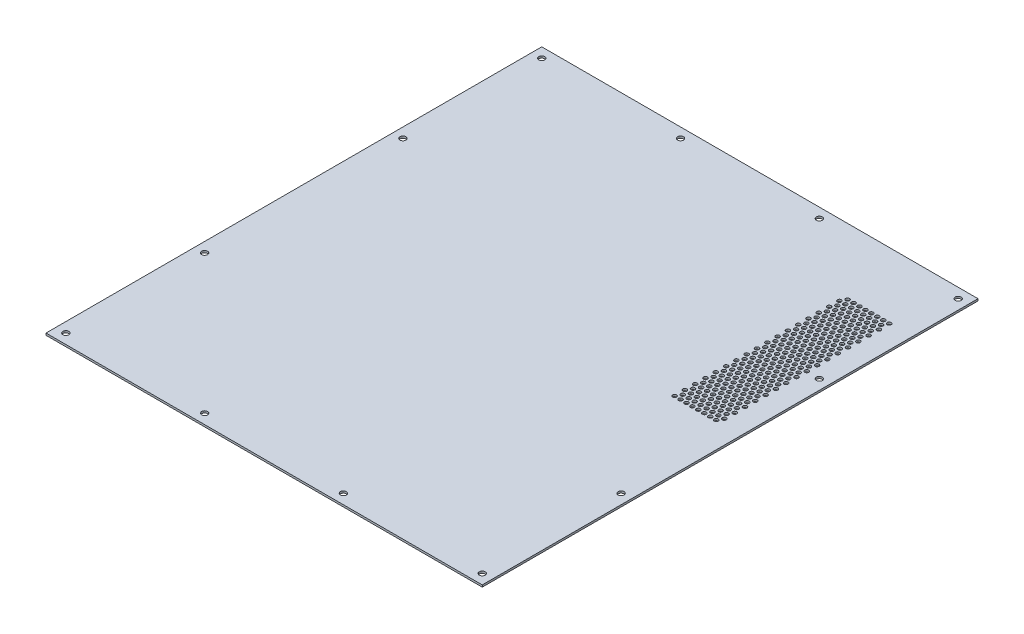
from build123d import *

# Parameters (mm, degrees)
SKETCH1_W           = 440
SKETCH1_H           = 500
SKETCH1_R           = 2
SKETCH1_R_2         = 3
BOSS_EXTRUDE1_DEPTH = 2


with BuildPart() as part:
    # Sketch1 → Boss-Extrude1 (new body)
    with BuildSketch(Plane(origin=(0, 0, 0), x_dir=(1, 0, 0), z_dir=(0, 1, 0))):
        with Locations((220, 250)):
            Rectangle(SKETCH1_W, SKETCH1_H)
        with Locations((372, 262)):
            Circle(SKETCH1_R, mode=Mode.SUBTRACT)
        with Locations((375, 267.196152423)):
            Circle(SKETCH1_R, mode=Mode.SUBTRACT)
        with Locations((381, 267.196152423)):
            Circle(SKETCH1_R, mode=Mode.SUBTRACT)
        with Locations((378, 262)):
            Circle(SKETCH1_R, mode=Mode.SUBTRACT)
        with Locations((387, 267.196152423)):
            Circle(SKETCH1_R, mode=Mode.SUBTRACT)
        with Locations((384, 262)):
            Circle(SKETCH1_R, mode=Mode.SUBTRACT)
        with Locations((393, 267.196152423)):
            Circle(SKETCH1_R, mode=Mode.SUBTRACT)
        with Locations((390, 262)):
            Circle(SKETCH1_R, mode=Mode.SUBTRACT)
        with Locations((399, 267.196152423)):
            Circle(SKETCH1_R, mode=Mode.SUBTRACT)
        with Locations((396, 262)):
            Circle(SKETCH1_R, mode=Mode.SUBTRACT)
        with Locations((405, 267.196152423)):
            Circle(SKETCH1_R, mode=Mode.SUBTRACT)
        with Locations((402, 262)):
            Circle(SKETCH1_R, mode=Mode.SUBTRACT)
        with Locations((411, 267.196152423)):
            Circle(SKETCH1_R, mode=Mode.SUBTRACT)
        with Locations((408, 262)):
            Circle(SKETCH1_R, mode=Mode.SUBTRACT)
        with Locations((417, 267.196152423)):
            Circle(SKETCH1_R, mode=Mode.SUBTRACT)
        with Locations((414, 262)):
            Circle(SKETCH1_R, mode=Mode.SUBTRACT)
        with Locations((381, 277.586152423)):
            Circle(SKETCH1_R, mode=Mode.SUBTRACT)
        with Locations((378, 272.39)):
            Circle(SKETCH1_R, mode=Mode.SUBTRACT)
        with Locations((387, 277.586152423)):
            Circle(SKETCH1_R, mode=Mode.SUBTRACT)
        with Locations((384, 272.39)):
            Circle(SKETCH1_R, mode=Mode.SUBTRACT)
        with Locations((393, 277.586152423)):
            Circle(SKETCH1_R, mode=Mode.SUBTRACT)
        with Locations((390, 272.39)):
            Circle(SKETCH1_R, mode=Mode.SUBTRACT)
        with Locations((399, 277.586152423)):
            Circle(SKETCH1_R, mode=Mode.SUBTRACT)
        with Locations((396, 272.39)):
            Circle(SKETCH1_R, mode=Mode.SUBTRACT)
        with Locations((405, 277.586152423)):
            Circle(SKETCH1_R, mode=Mode.SUBTRACT)
        with Locations((402, 272.39)):
            Circle(SKETCH1_R, mode=Mode.SUBTRACT)
        with Locations((411, 277.586152423)):
            Circle(SKETCH1_R, mode=Mode.SUBTRACT)
        with Locations((408, 272.39)):
            Circle(SKETCH1_R, mode=Mode.SUBTRACT)
        with Locations((417, 277.586152423)):
            Circle(SKETCH1_R, mode=Mode.SUBTRACT)
        with Locations((414, 272.39)):
            Circle(SKETCH1_R, mode=Mode.SUBTRACT)
        with Locations((381, 287.976152423)):
            Circle(SKETCH1_R, mode=Mode.SUBTRACT)
        with Locations((378, 282.78)):
            Circle(SKETCH1_R, mode=Mode.SUBTRACT)
        with Locations((387, 287.976152423)):
            Circle(SKETCH1_R, mode=Mode.SUBTRACT)
        with Locations((384, 282.78)):
            Circle(SKETCH1_R, mode=Mode.SUBTRACT)
        with Locations((393, 287.976152423)):
            Circle(SKETCH1_R, mode=Mode.SUBTRACT)
        with Locations((390, 282.78)):
            Circle(SKETCH1_R, mode=Mode.SUBTRACT)
        with Locations((399, 287.976152423)):
            Circle(SKETCH1_R, mode=Mode.SUBTRACT)
        with Locations((396, 282.78)):
            Circle(SKETCH1_R, mode=Mode.SUBTRACT)
        with Locations((405, 287.976152423)):
            Circle(SKETCH1_R, mode=Mode.SUBTRACT)
        with Locations((402, 282.78)):
            Circle(SKETCH1_R, mode=Mode.SUBTRACT)
        with Locations((411, 287.976152423)):
            Circle(SKETCH1_R, mode=Mode.SUBTRACT)
        with Locations((408, 282.78)):
            Circle(SKETCH1_R, mode=Mode.SUBTRACT)
        with Locations((417, 287.976152423)):
            Circle(SKETCH1_R, mode=Mode.SUBTRACT)
        with Locations((414, 282.78)):
            Circle(SKETCH1_R, mode=Mode.SUBTRACT)
        with Locations((381, 298.366152423)):
            Circle(SKETCH1_R, mode=Mode.SUBTRACT)
        with Locations((378, 293.17)):
            Circle(SKETCH1_R, mode=Mode.SUBTRACT)
        with Locations((387, 298.366152423)):
            Circle(SKETCH1_R, mode=Mode.SUBTRACT)
        with Locations((384, 293.17)):
            Circle(SKETCH1_R, mode=Mode.SUBTRACT)
        with Locations((393, 298.366152423)):
            Circle(SKETCH1_R, mode=Mode.SUBTRACT)
        with Locations((390, 293.17)):
            Circle(SKETCH1_R, mode=Mode.SUBTRACT)
        with Locations((399, 298.366152423)):
            Circle(SKETCH1_R, mode=Mode.SUBTRACT)
        with Locations((396, 293.17)):
            Circle(SKETCH1_R, mode=Mode.SUBTRACT)
        with Locations((405, 298.366152423)):
            Circle(SKETCH1_R, mode=Mode.SUBTRACT)
        with Locations((402, 293.17)):
            Circle(SKETCH1_R, mode=Mode.SUBTRACT)
        with Locations((411, 298.366152423)):
            Circle(SKETCH1_R, mode=Mode.SUBTRACT)
        with Locations((408, 293.17)):
            Circle(SKETCH1_R, mode=Mode.SUBTRACT)
        with Locations((417, 298.366152423)):
            Circle(SKETCH1_R, mode=Mode.SUBTRACT)
        with Locations((414, 293.17)):
            Circle(SKETCH1_R, mode=Mode.SUBTRACT)
        with Locations((381, 308.756152423)):
            Circle(SKETCH1_R, mode=Mode.SUBTRACT)
        with Locations((378, 303.56)):
            Circle(SKETCH1_R, mode=Mode.SUBTRACT)
        with Locations((387, 308.756152423)):
            Circle(SKETCH1_R, mode=Mode.SUBTRACT)
        with Locations((384, 303.56)):
            Circle(SKETCH1_R, mode=Mode.SUBTRACT)
        with Locations((393, 308.756152423)):
            Circle(SKETCH1_R, mode=Mode.SUBTRACT)
        with Locations((390, 303.56)):
            Circle(SKETCH1_R, mode=Mode.SUBTRACT)
        with Locations((399, 308.756152423)):
            Circle(SKETCH1_R, mode=Mode.SUBTRACT)
        with Locations((396, 303.56)):
            Circle(SKETCH1_R, mode=Mode.SUBTRACT)
        with Locations((405, 308.756152423)):
            Circle(SKETCH1_R, mode=Mode.SUBTRACT)
        with Locations((402, 303.56)):
            Circle(SKETCH1_R, mode=Mode.SUBTRACT)
        with Locations((411, 308.756152423)):
            Circle(SKETCH1_R, mode=Mode.SUBTRACT)
        with Locations((408, 303.56)):
            Circle(SKETCH1_R, mode=Mode.SUBTRACT)
        with Locations((417, 308.756152423)):
            Circle(SKETCH1_R, mode=Mode.SUBTRACT)
        with Locations((414, 303.56)):
            Circle(SKETCH1_R, mode=Mode.SUBTRACT)
        with Locations((381, 319.146152423)):
            Circle(SKETCH1_R, mode=Mode.SUBTRACT)
        with Locations((378, 313.95)):
            Circle(SKETCH1_R, mode=Mode.SUBTRACT)
        with Locations((387, 319.146152423)):
            Circle(SKETCH1_R, mode=Mode.SUBTRACT)
        with Locations((384, 313.95)):
            Circle(SKETCH1_R, mode=Mode.SUBTRACT)
        with Locations((393, 319.146152423)):
            Circle(SKETCH1_R, mode=Mode.SUBTRACT)
        with Locations((390, 313.95)):
            Circle(SKETCH1_R, mode=Mode.SUBTRACT)
        with Locations((399, 319.146152423)):
            Circle(SKETCH1_R, mode=Mode.SUBTRACT)
        with Locations((396, 313.95)):
            Circle(SKETCH1_R, mode=Mode.SUBTRACT)
        with Locations((405, 319.146152423)):
            Circle(SKETCH1_R, mode=Mode.SUBTRACT)
        with Locations((402, 313.95)):
            Circle(SKETCH1_R, mode=Mode.SUBTRACT)
        with Locations((411, 319.146152423)):
            Circle(SKETCH1_R, mode=Mode.SUBTRACT)
        with Locations((408, 313.95)):
            Circle(SKETCH1_R, mode=Mode.SUBTRACT)
        with Locations((417, 319.146152423)):
            Circle(SKETCH1_R, mode=Mode.SUBTRACT)
        with Locations((414, 313.95)):
            Circle(SKETCH1_R, mode=Mode.SUBTRACT)
        with Locations((381, 329.536152423)):
            Circle(SKETCH1_R, mode=Mode.SUBTRACT)
        with Locations((378, 324.34)):
            Circle(SKETCH1_R, mode=Mode.SUBTRACT)
        with Locations((387, 329.536152423)):
            Circle(SKETCH1_R, mode=Mode.SUBTRACT)
        with Locations((384, 324.34)):
            Circle(SKETCH1_R, mode=Mode.SUBTRACT)
        with Locations((393, 329.536152423)):
            Circle(SKETCH1_R, mode=Mode.SUBTRACT)
        with Locations((390, 324.34)):
            Circle(SKETCH1_R, mode=Mode.SUBTRACT)
        with Locations((399, 329.536152423)):
            Circle(SKETCH1_R, mode=Mode.SUBTRACT)
        with Locations((396, 324.34)):
            Circle(SKETCH1_R, mode=Mode.SUBTRACT)
        with Locations((405, 329.536152423)):
            Circle(SKETCH1_R, mode=Mode.SUBTRACT)
        with Locations((402, 324.34)):
            Circle(SKETCH1_R, mode=Mode.SUBTRACT)
        with Locations((411, 329.536152423)):
            Circle(SKETCH1_R, mode=Mode.SUBTRACT)
        with Locations((408, 324.34)):
            Circle(SKETCH1_R, mode=Mode.SUBTRACT)
        with Locations((417, 329.536152423)):
            Circle(SKETCH1_R, mode=Mode.SUBTRACT)
        with Locations((414, 324.34)):
            Circle(SKETCH1_R, mode=Mode.SUBTRACT)
        with Locations((381, 339.926152423)):
            Circle(SKETCH1_R, mode=Mode.SUBTRACT)
        with Locations((378, 334.73)):
            Circle(SKETCH1_R, mode=Mode.SUBTRACT)
        with Locations((387, 339.926152423)):
            Circle(SKETCH1_R, mode=Mode.SUBTRACT)
        with Locations((384, 334.73)):
            Circle(SKETCH1_R, mode=Mode.SUBTRACT)
        with Locations((393, 339.926152423)):
            Circle(SKETCH1_R, mode=Mode.SUBTRACT)
        with Locations((390, 334.73)):
            Circle(SKETCH1_R, mode=Mode.SUBTRACT)
        with Locations((399, 339.926152423)):
            Circle(SKETCH1_R, mode=Mode.SUBTRACT)
        with Locations((396, 334.73)):
            Circle(SKETCH1_R, mode=Mode.SUBTRACT)
        with Locations((405, 339.926152423)):
            Circle(SKETCH1_R, mode=Mode.SUBTRACT)
        with Locations((402, 334.73)):
            Circle(SKETCH1_R, mode=Mode.SUBTRACT)
        with Locations((411, 339.926152423)):
            Circle(SKETCH1_R, mode=Mode.SUBTRACT)
        with Locations((408, 334.73)):
            Circle(SKETCH1_R, mode=Mode.SUBTRACT)
        with Locations((417, 339.926152423)):
            Circle(SKETCH1_R, mode=Mode.SUBTRACT)
        with Locations((414, 334.73)):
            Circle(SKETCH1_R, mode=Mode.SUBTRACT)
        with Locations((381, 350.316152423)):
            Circle(SKETCH1_R, mode=Mode.SUBTRACT)
        with Locations((378, 345.12)):
            Circle(SKETCH1_R, mode=Mode.SUBTRACT)
        with Locations((387, 350.316152423)):
            Circle(SKETCH1_R, mode=Mode.SUBTRACT)
        with Locations((384, 345.12)):
            Circle(SKETCH1_R, mode=Mode.SUBTRACT)
        with Locations((393, 350.316152423)):
            Circle(SKETCH1_R, mode=Mode.SUBTRACT)
        with Locations((390, 345.12)):
            Circle(SKETCH1_R, mode=Mode.SUBTRACT)
        with Locations((399, 350.316152423)):
            Circle(SKETCH1_R, mode=Mode.SUBTRACT)
        with Locations((396, 345.12)):
            Circle(SKETCH1_R, mode=Mode.SUBTRACT)
        with Locations((405, 350.316152423)):
            Circle(SKETCH1_R, mode=Mode.SUBTRACT)
        with Locations((402, 345.12)):
            Circle(SKETCH1_R, mode=Mode.SUBTRACT)
        with Locations((411, 350.316152423)):
            Circle(SKETCH1_R, mode=Mode.SUBTRACT)
        with Locations((408, 345.12)):
            Circle(SKETCH1_R, mode=Mode.SUBTRACT)
        with Locations((417, 350.316152423)):
            Circle(SKETCH1_R, mode=Mode.SUBTRACT)
        with Locations((414, 345.12)):
            Circle(SKETCH1_R, mode=Mode.SUBTRACT)
        with Locations((381, 360.706152423)):
            Circle(SKETCH1_R, mode=Mode.SUBTRACT)
        with Locations((378, 355.51)):
            Circle(SKETCH1_R, mode=Mode.SUBTRACT)
        with Locations((387, 360.706152423)):
            Circle(SKETCH1_R, mode=Mode.SUBTRACT)
        with Locations((384, 355.51)):
            Circle(SKETCH1_R, mode=Mode.SUBTRACT)
        with Locations((393, 360.706152423)):
            Circle(SKETCH1_R, mode=Mode.SUBTRACT)
        with Locations((390, 355.51)):
            Circle(SKETCH1_R, mode=Mode.SUBTRACT)
        with Locations((399, 360.706152423)):
            Circle(SKETCH1_R, mode=Mode.SUBTRACT)
        with Locations((396, 355.51)):
            Circle(SKETCH1_R, mode=Mode.SUBTRACT)
        with Locations((405, 360.706152423)):
            Circle(SKETCH1_R, mode=Mode.SUBTRACT)
        with Locations((402, 355.51)):
            Circle(SKETCH1_R, mode=Mode.SUBTRACT)
        with Locations((411, 360.706152423)):
            Circle(SKETCH1_R, mode=Mode.SUBTRACT)
        with Locations((408, 355.51)):
            Circle(SKETCH1_R, mode=Mode.SUBTRACT)
        with Locations((417, 360.706152423)):
            Circle(SKETCH1_R, mode=Mode.SUBTRACT)
        with Locations((414, 355.51)):
            Circle(SKETCH1_R, mode=Mode.SUBTRACT)
        with Locations((381, 371.096152423)):
            Circle(SKETCH1_R, mode=Mode.SUBTRACT)
        with Locations((378, 365.9)):
            Circle(SKETCH1_R, mode=Mode.SUBTRACT)
        with Locations((387, 371.096152423)):
            Circle(SKETCH1_R, mode=Mode.SUBTRACT)
        with Locations((384, 365.9)):
            Circle(SKETCH1_R, mode=Mode.SUBTRACT)
        with Locations((393, 371.096152423)):
            Circle(SKETCH1_R, mode=Mode.SUBTRACT)
        with Locations((390, 365.9)):
            Circle(SKETCH1_R, mode=Mode.SUBTRACT)
        with Locations((399, 371.096152423)):
            Circle(SKETCH1_R, mode=Mode.SUBTRACT)
        with Locations((396, 365.9)):
            Circle(SKETCH1_R, mode=Mode.SUBTRACT)
        with Locations((405, 371.096152423)):
            Circle(SKETCH1_R, mode=Mode.SUBTRACT)
        with Locations((402, 365.9)):
            Circle(SKETCH1_R, mode=Mode.SUBTRACT)
        with Locations((411, 371.096152423)):
            Circle(SKETCH1_R, mode=Mode.SUBTRACT)
        with Locations((408, 365.9)):
            Circle(SKETCH1_R, mode=Mode.SUBTRACT)
        with Locations((417, 371.096152423)):
            Circle(SKETCH1_R, mode=Mode.SUBTRACT)
        with Locations((414, 365.9)):
            Circle(SKETCH1_R, mode=Mode.SUBTRACT)
        with Locations((381, 381.486152423)):
            Circle(SKETCH1_R, mode=Mode.SUBTRACT)
        with Locations((378, 376.29)):
            Circle(SKETCH1_R, mode=Mode.SUBTRACT)
        with Locations((387, 381.486152423)):
            Circle(SKETCH1_R, mode=Mode.SUBTRACT)
        with Locations((384, 376.29)):
            Circle(SKETCH1_R, mode=Mode.SUBTRACT)
        with Locations((393, 381.486152423)):
            Circle(SKETCH1_R, mode=Mode.SUBTRACT)
        with Locations((390, 376.29)):
            Circle(SKETCH1_R, mode=Mode.SUBTRACT)
        with Locations((399, 381.486152423)):
            Circle(SKETCH1_R, mode=Mode.SUBTRACT)
        with Locations((396, 376.29)):
            Circle(SKETCH1_R, mode=Mode.SUBTRACT)
        with Locations((405, 381.486152423)):
            Circle(SKETCH1_R, mode=Mode.SUBTRACT)
        with Locations((402, 376.29)):
            Circle(SKETCH1_R, mode=Mode.SUBTRACT)
        with Locations((411, 381.486152423)):
            Circle(SKETCH1_R, mode=Mode.SUBTRACT)
        with Locations((408, 376.29)):
            Circle(SKETCH1_R, mode=Mode.SUBTRACT)
        with Locations((417, 381.486152423)):
            Circle(SKETCH1_R, mode=Mode.SUBTRACT)
        with Locations((414, 376.29)):
            Circle(SKETCH1_R, mode=Mode.SUBTRACT)
        with Locations((381, 391.876152423)):
            Circle(SKETCH1_R, mode=Mode.SUBTRACT)
        with Locations((378, 386.68)):
            Circle(SKETCH1_R, mode=Mode.SUBTRACT)
        with Locations((387, 391.876152423)):
            Circle(SKETCH1_R, mode=Mode.SUBTRACT)
        with Locations((384, 386.68)):
            Circle(SKETCH1_R, mode=Mode.SUBTRACT)
        with Locations((393, 391.876152423)):
            Circle(SKETCH1_R, mode=Mode.SUBTRACT)
        with Locations((390, 386.68)):
            Circle(SKETCH1_R, mode=Mode.SUBTRACT)
        with Locations((399, 391.876152423)):
            Circle(SKETCH1_R, mode=Mode.SUBTRACT)
        with Locations((396, 386.68)):
            Circle(SKETCH1_R, mode=Mode.SUBTRACT)
        with Locations((405, 391.876152423)):
            Circle(SKETCH1_R, mode=Mode.SUBTRACT)
        with Locations((402, 386.68)):
            Circle(SKETCH1_R, mode=Mode.SUBTRACT)
        with Locations((411, 391.876152423)):
            Circle(SKETCH1_R, mode=Mode.SUBTRACT)
        with Locations((408, 386.68)):
            Circle(SKETCH1_R, mode=Mode.SUBTRACT)
        with Locations((417, 391.876152423)):
            Circle(SKETCH1_R, mode=Mode.SUBTRACT)
        with Locations((414, 386.68)):
            Circle(SKETCH1_R, mode=Mode.SUBTRACT)
        with Locations((381, 402.266152423)):
            Circle(SKETCH1_R, mode=Mode.SUBTRACT)
        with Locations((378, 397.07)):
            Circle(SKETCH1_R, mode=Mode.SUBTRACT)
        with Locations((387, 402.266152423)):
            Circle(SKETCH1_R, mode=Mode.SUBTRACT)
        with Locations((384, 397.07)):
            Circle(SKETCH1_R, mode=Mode.SUBTRACT)
        with Locations((393, 402.266152423)):
            Circle(SKETCH1_R, mode=Mode.SUBTRACT)
        with Locations((390, 397.07)):
            Circle(SKETCH1_R, mode=Mode.SUBTRACT)
        with Locations((399, 402.266152423)):
            Circle(SKETCH1_R, mode=Mode.SUBTRACT)
        with Locations((396, 397.07)):
            Circle(SKETCH1_R, mode=Mode.SUBTRACT)
        with Locations((405, 402.266152423)):
            Circle(SKETCH1_R, mode=Mode.SUBTRACT)
        with Locations((402, 397.07)):
            Circle(SKETCH1_R, mode=Mode.SUBTRACT)
        with Locations((411, 402.266152423)):
            Circle(SKETCH1_R, mode=Mode.SUBTRACT)
        with Locations((408, 397.07)):
            Circle(SKETCH1_R, mode=Mode.SUBTRACT)
        with Locations((417, 402.266152423)):
            Circle(SKETCH1_R, mode=Mode.SUBTRACT)
        with Locations((414, 397.07)):
            Circle(SKETCH1_R, mode=Mode.SUBTRACT)
        with Locations((381, 412.656152423)):
            Circle(SKETCH1_R, mode=Mode.SUBTRACT)
        with Locations((378, 407.46)):
            Circle(SKETCH1_R, mode=Mode.SUBTRACT)
        with Locations((387, 412.656152423)):
            Circle(SKETCH1_R, mode=Mode.SUBTRACT)
        with Locations((384, 407.46)):
            Circle(SKETCH1_R, mode=Mode.SUBTRACT)
        with Locations((393, 412.656152423)):
            Circle(SKETCH1_R, mode=Mode.SUBTRACT)
        with Locations((390, 407.46)):
            Circle(SKETCH1_R, mode=Mode.SUBTRACT)
        with Locations((399, 412.656152423)):
            Circle(SKETCH1_R, mode=Mode.SUBTRACT)
        with Locations((396, 407.46)):
            Circle(SKETCH1_R, mode=Mode.SUBTRACT)
        with Locations((405, 412.656152423)):
            Circle(SKETCH1_R, mode=Mode.SUBTRACT)
        with Locations((402, 407.46)):
            Circle(SKETCH1_R, mode=Mode.SUBTRACT)
        with Locations((411, 412.656152423)):
            Circle(SKETCH1_R, mode=Mode.SUBTRACT)
        with Locations((408, 407.46)):
            Circle(SKETCH1_R, mode=Mode.SUBTRACT)
        with Locations((417, 412.656152423)):
            Circle(SKETCH1_R, mode=Mode.SUBTRACT)
        with Locations((414, 407.46)):
            Circle(SKETCH1_R, mode=Mode.SUBTRACT)
        with Locations((381, 423.046152423)):
            Circle(SKETCH1_R, mode=Mode.SUBTRACT)
        with Locations((378, 417.85)):
            Circle(SKETCH1_R, mode=Mode.SUBTRACT)
        with Locations((387, 423.046152423)):
            Circle(SKETCH1_R, mode=Mode.SUBTRACT)
        with Locations((384, 417.85)):
            Circle(SKETCH1_R, mode=Mode.SUBTRACT)
        with Locations((393, 423.046152423)):
            Circle(SKETCH1_R, mode=Mode.SUBTRACT)
        with Locations((390, 417.85)):
            Circle(SKETCH1_R, mode=Mode.SUBTRACT)
        with Locations((399, 423.046152423)):
            Circle(SKETCH1_R, mode=Mode.SUBTRACT)
        with Locations((396, 417.85)):
            Circle(SKETCH1_R, mode=Mode.SUBTRACT)
        with Locations((405, 423.046152423)):
            Circle(SKETCH1_R, mode=Mode.SUBTRACT)
        with Locations((402, 417.85)):
            Circle(SKETCH1_R, mode=Mode.SUBTRACT)
        with Locations((411, 423.046152423)):
            Circle(SKETCH1_R, mode=Mode.SUBTRACT)
        with Locations((408, 417.85)):
            Circle(SKETCH1_R, mode=Mode.SUBTRACT)
        with Locations((417, 423.046152423)):
            Circle(SKETCH1_R, mode=Mode.SUBTRACT)
        with Locations((414, 417.85)):
            Circle(SKETCH1_R, mode=Mode.SUBTRACT)
        with Locations((381, 433.436152423)):
            Circle(SKETCH1_R, mode=Mode.SUBTRACT)
        with Locations((378, 428.24)):
            Circle(SKETCH1_R, mode=Mode.SUBTRACT)
        with Locations((387, 433.436152423)):
            Circle(SKETCH1_R, mode=Mode.SUBTRACT)
        with Locations((384, 428.24)):
            Circle(SKETCH1_R, mode=Mode.SUBTRACT)
        with Locations((393, 433.436152423)):
            Circle(SKETCH1_R, mode=Mode.SUBTRACT)
        with Locations((390, 428.24)):
            Circle(SKETCH1_R, mode=Mode.SUBTRACT)
        with Locations((399, 433.436152423)):
            Circle(SKETCH1_R, mode=Mode.SUBTRACT)
        with Locations((396, 428.24)):
            Circle(SKETCH1_R, mode=Mode.SUBTRACT)
        with Locations((405, 433.436152423)):
            Circle(SKETCH1_R, mode=Mode.SUBTRACT)
        with Locations((402, 428.24)):
            Circle(SKETCH1_R, mode=Mode.SUBTRACT)
        with Locations((411, 433.436152423)):
            Circle(SKETCH1_R, mode=Mode.SUBTRACT)
        with Locations((408, 428.24)):
            Circle(SKETCH1_R, mode=Mode.SUBTRACT)
        with Locations((417, 433.436152423)):
            Circle(SKETCH1_R, mode=Mode.SUBTRACT)
        with Locations((414, 428.24)):
            Circle(SKETCH1_R, mode=Mode.SUBTRACT)
        with Locations((375, 277.586152423)):
            Circle(SKETCH1_R, mode=Mode.SUBTRACT)
        with Locations((372, 272.39)):
            Circle(SKETCH1_R, mode=Mode.SUBTRACT)
        with Locations((375, 287.976152423)):
            Circle(SKETCH1_R, mode=Mode.SUBTRACT)
        with Locations((372, 282.78)):
            Circle(SKETCH1_R, mode=Mode.SUBTRACT)
        with Locations((375, 298.366152423)):
            Circle(SKETCH1_R, mode=Mode.SUBTRACT)
        with Locations((372, 293.17)):
            Circle(SKETCH1_R, mode=Mode.SUBTRACT)
        with Locations((375, 308.756152423)):
            Circle(SKETCH1_R, mode=Mode.SUBTRACT)
        with Locations((372, 303.56)):
            Circle(SKETCH1_R, mode=Mode.SUBTRACT)
        with Locations((375, 319.146152423)):
            Circle(SKETCH1_R, mode=Mode.SUBTRACT)
        with Locations((372, 313.95)):
            Circle(SKETCH1_R, mode=Mode.SUBTRACT)
        with Locations((375, 329.536152423)):
            Circle(SKETCH1_R, mode=Mode.SUBTRACT)
        with Locations((372, 324.34)):
            Circle(SKETCH1_R, mode=Mode.SUBTRACT)
        with Locations((375, 339.926152423)):
            Circle(SKETCH1_R, mode=Mode.SUBTRACT)
        with Locations((372, 334.73)):
            Circle(SKETCH1_R, mode=Mode.SUBTRACT)
        with Locations((375, 350.316152423)):
            Circle(SKETCH1_R, mode=Mode.SUBTRACT)
        with Locations((372, 345.12)):
            Circle(SKETCH1_R, mode=Mode.SUBTRACT)
        with Locations((375, 360.706152423)):
            Circle(SKETCH1_R, mode=Mode.SUBTRACT)
        with Locations((372, 355.51)):
            Circle(SKETCH1_R, mode=Mode.SUBTRACT)
        with Locations((375, 371.096152423)):
            Circle(SKETCH1_R, mode=Mode.SUBTRACT)
        with Locations((372, 365.9)):
            Circle(SKETCH1_R, mode=Mode.SUBTRACT)
        with Locations((375, 381.486152423)):
            Circle(SKETCH1_R, mode=Mode.SUBTRACT)
        with Locations((372, 376.29)):
            Circle(SKETCH1_R, mode=Mode.SUBTRACT)
        with Locations((375, 391.876152423)):
            Circle(SKETCH1_R, mode=Mode.SUBTRACT)
        with Locations((372, 386.68)):
            Circle(SKETCH1_R, mode=Mode.SUBTRACT)
        with Locations((375, 402.266152423)):
            Circle(SKETCH1_R, mode=Mode.SUBTRACT)
        with Locations((372, 397.07)):
            Circle(SKETCH1_R, mode=Mode.SUBTRACT)
        with Locations((375, 412.656152423)):
            Circle(SKETCH1_R, mode=Mode.SUBTRACT)
        with Locations((372, 407.46)):
            Circle(SKETCH1_R, mode=Mode.SUBTRACT)
        with Locations((375, 423.046152423)):
            Circle(SKETCH1_R, mode=Mode.SUBTRACT)
        with Locations((372, 417.85)):
            Circle(SKETCH1_R, mode=Mode.SUBTRACT)
        with Locations((375, 433.436152423)):
            Circle(SKETCH1_R, mode=Mode.SUBTRACT)
        with Locations((372, 428.24)):
            Circle(SKETCH1_R, mode=Mode.SUBTRACT)
        with Locations((10, 490)):
            Circle(SKETCH1_R_2, mode=Mode.SUBTRACT)
        with Locations((430, 490)):
            Circle(SKETCH1_R_2, mode=Mode.SUBTRACT)
        with Locations((430, 10)):
            Circle(SKETCH1_R_2, mode=Mode.SUBTRACT)
        with Locations((10, 10)):
            Circle(SKETCH1_R_2, mode=Mode.SUBTRACT)
        with Locations((430, 150)):
            Circle(SKETCH1_R_2, mode=Mode.SUBTRACT)
        with Locations((430, 350)):
            Circle(SKETCH1_R_2, mode=Mode.SUBTRACT)
        with Locations((10, 150)):
            Circle(SKETCH1_R_2, mode=Mode.SUBTRACT)
        with Locations((10, 350)):
            Circle(SKETCH1_R_2, mode=Mode.SUBTRACT)
        with Locations((150, 10)):
            Circle(SKETCH1_R_2, mode=Mode.SUBTRACT)
        with Locations((290, 10)):
            Circle(SKETCH1_R_2, mode=Mode.SUBTRACT)
        with Locations((150, 490)):
            Circle(SKETCH1_R_2, mode=Mode.SUBTRACT)
        with Locations((290, 490)):
            Circle(SKETCH1_R_2, mode=Mode.SUBTRACT)
    extrude(amount=BOSS_EXTRUDE1_DEPTH)


solid = part.part
